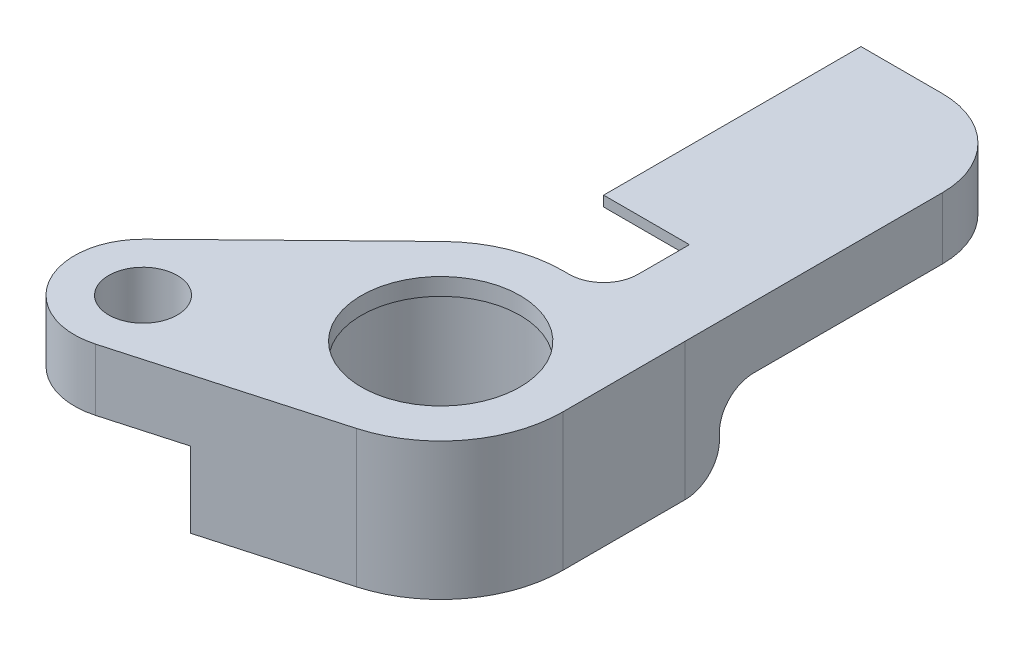
from build123d import *

# Parameters (mm, degrees)
BOSS_EXTRUDE1_DEPTH = 16
SKETCH13_R          = 11.25
CUT_EXTRUDE5_DEPTH  = 14
SKETCH14_R          = 12
CUT_EXTRUDE6_DEPTH  = 8.8
SKETCH15_R          = 9.25
CUT_EXTRUDE7_DEPTH  = 78.41184293
SKETCH17_R          = 4
CUT_EXTRUDE8_DEPTH  = 77.64224309
FILLET1_R           = 4
SKETCH18_W          = 10
SKETCH18_H          = 30
BOSS_EXTRUDE2_DEPTH = 1.2
SKETCH19_W          = 9.5
SKETCH19_H          = 36
CUT_EXTRUDE9_DEPTH  = 8.8
FILLET2_R           = 4
FILLET3_R           = 10


with BuildPart() as part:
    # Sketch2 → Boss-Extrude1 (new body)
    with BuildSketch(Plane(origin=(0, 0, 0), x_dir=(1, 0, 0), z_dir=(0, 1, 0))):
        with BuildLine():
            Line((26.74332389, 26.951705922), (22, 26.951705922))
            ThreePointArc((22, 26.951705922), (16.633883839, 25.902739872), (12.057785035, 22.91027397))
            Line((12.057785035, 22.91027397), (-5.581594366, 5.731125922))
            ThreePointArc((-5.581594366, 5.731125922), (-6.92820323, -4), (2.172503457, -7.699365476))
            Line((2.172503457, -7.699365476), (25.869771783, -1.012788831))
            ThreePointArc((25.869771783, -1.012788831), (33.364381258, 4.104419222), (36.249998435, 12.708383596))
            Line((36.249998435, 12.708383596), (36.24332389, 26.951705922))
            Line((36.24332389, 26.951705922), (36.24332389, 66.951705922))
            Line((36.24332389, 66.951705922), (26.74332389, 66.951705922))
            Line((26.74332389, 66.951705922), (26.74332389, 26.951705922))
        make_face()
    extrude(amount=BOSS_EXTRUDE1_DEPTH)

    # Sketch13 → Cut-Extrude5 (cut)
    with BuildSketch(Plane.XZ):
        with Locations(Location((22, -12.701705922, 0), (0, 0, 270))):
            Circle(SKETCH13_R)
    extrude(amount=-CUT_EXTRUDE5_DEPTH, mode=Mode.SUBTRACT)

    # Sketch14 → Cut-Extrude6 (cut)
    with BuildSketch(Plane.XZ):
        Circle(SKETCH14_R)
    extrude(amount=-CUT_EXTRUDE6_DEPTH, mode=Mode.SUBTRACT)

    # Sketch15 → Cut-Extrude7 (cut, through all)
    with BuildSketch(Plane.XZ.offset(-14)):
        with Locations(Location((22, -12.701705922, 0), (0, 0, 270))):
            Circle(SKETCH15_R)
    extrude(amount=-CUT_EXTRUDE7_DEPTH, mode=Mode.SUBTRACT)

    # Sketch17 → Cut-Extrude8 (cut, through all)
    with BuildSketch(Plane.XZ.offset(-8.8)):
        with Locations(Location((0, 0, 0), (0, 0, 270))):
            Circle(SKETCH17_R)
    extrude(amount=-CUT_EXTRUDE8_DEPTH, mode=Mode.SUBTRACT)

    # Fillet1
    fillet1_edges = [part.edges().sort_by_distance(p)[0] for p in [
        (26.74332389, 8, -26.951705922),
    ]]
    fillet(fillet1_edges, radius=FILLET1_R)

    # Sketch18 → Boss-Extrude2 (add)
    with BuildSketch(Plane(origin=(0, 16, 0), x_dir=(1, 0, 0), z_dir=(0, 1, 0))):
        with Locations((21.74332389, 51.951705922)):
            Rectangle(SKETCH18_W, SKETCH18_H)
    extrude(amount=-BOSS_EXTRUDE2_DEPTH)

    # Sketch19 → Cut-Extrude9 (cut)
    with BuildSketch(Plane.XZ):
        with Locations((31.49332389, -48.951705922)):
            Rectangle(SKETCH19_W, SKETCH19_H)
    extrude(amount=-CUT_EXTRUDE9_DEPTH, mode=Mode.SUBTRACT)

    # Fillet2
    fillet2_edges = [part.edges().sort_by_distance(p)[0] for p in [
        (31.49332389, 0, -30.951705922),
        (31.49332389, 8.8, -30.951705922),
    ]]
    fillet(fillet2_edges, radius=FILLET2_R - 0.0001)  # a hair under: the kernel refuses the full size

    # Fillet3
    fillet3_edges = [part.edges().sort_by_distance(p)[0] for p in [
        (36.24332389, 12.4, -66.951705922),
    ]]
    fillet(fillet3_edges, radius=FILLET3_R)


solid = part.part
